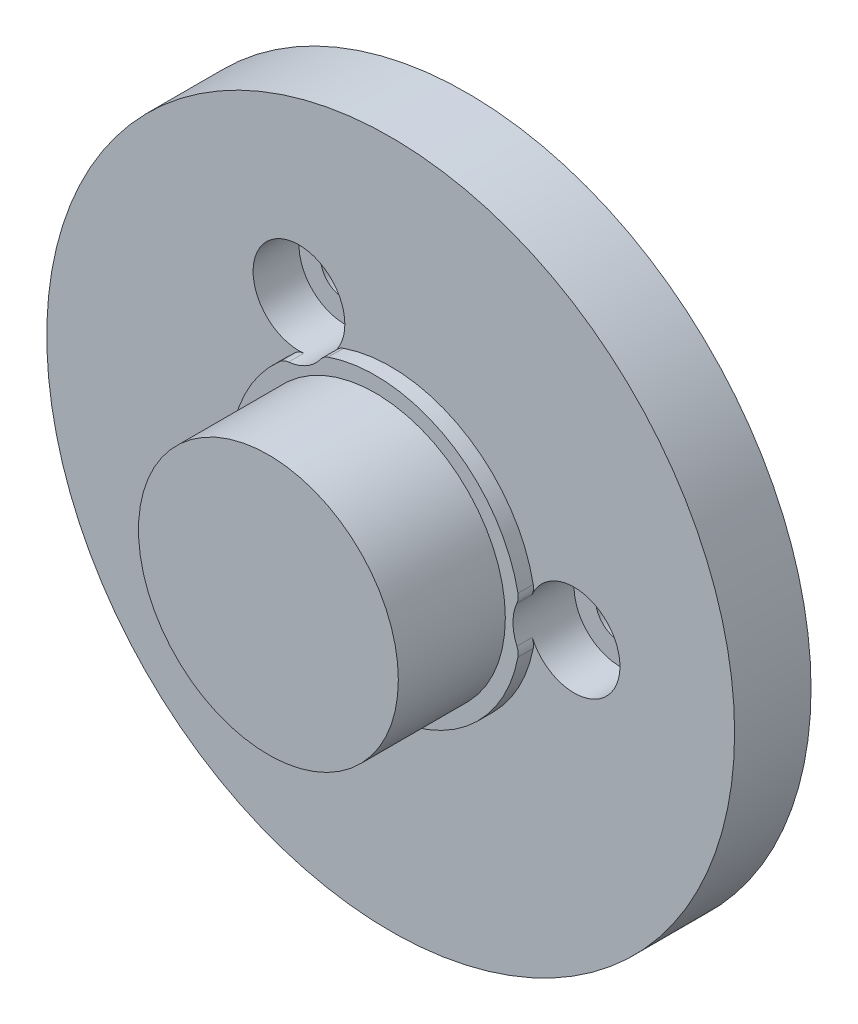
from build123d import *
from build123d.topology import SkipClean

# Parameters (mm, degrees)
SKETCH1_R           = 22.499999999999996
SKETCH1_R_2         = 1.6
SKETCH1_R_3         = 1.6000000000000016
BOSS_EXTRUDE1_DEPTH = 5
SKETCH2_R           = 3.0000000000000004
SKETCH2_R_2         = 2.999999999999999
CUT_EXTRUDE1_DEPTH  = 3
BOSS_EXTRUDE2_START = 1
BOSS_EXTRUDE2_DEPTH = 1
SKETCH4_R           = 8.499999999997954
BOSS_EXTRUDE3_DEPTH = 7
FILLET1_R           = 1


with BuildPart() as part:
    # Sketch1 → Boss-Extrude1 (new body)
    with BuildSketch(Plane.XY.offset(31)):
        Circle(SKETCH1_R)
        with Locations((-6.000000000000005, 10.392304845413262)):
            Circle(SKETCH1_R_2, mode=Mode.SUBTRACT)
        with Locations((-5.999999999999998, -10.392304845413266)):
            Circle(SKETCH1_R_2, mode=Mode.SUBTRACT)
        with Locations((12, 0)):
            Circle(SKETCH1_R_3, mode=Mode.SUBTRACT)
    extrude(amount=BOSS_EXTRUDE1_DEPTH)

    # Sketch2 → Cut-Extrude1 (cut)
    with BuildSketch(Plane.XY.offset(36)):
        with Locations((-6.000000000000005, 10.392304845413262)):
            Circle(SKETCH2_R)
        with Locations((12, 0)):
            Circle(SKETCH2_R_2)
        with Locations((-5.999999999999998, -10.392304845413266)):
            Circle(SKETCH2_R)
    extrude(amount=-CUT_EXTRUDE1_DEPTH, mode=Mode.SUBTRACT)

    # Sketch3 → Boss-Extrude2 (add)
    with SkipClean():  # the faces are left unmerged after this step: merging them gives an invalid solid
        with BuildSketch(Plane.XY.offset(36).offset(BOSS_EXTRUDE2_START)):
            with BuildLine():
                ThreePointArc((9.385416666666513, -1.4710384063833113), (9, -2.3e-15), (9.385416666666512, 1.4710384063833084))
                ThreePointArc((9.385416666666718, 1.4710384063832629), (4.750000000000321, 8.227241335951982), (-3.4187517034621835, 8.863528461627142))
                ThreePointArc((-3.41875170346237, 8.863528461627341), (-4.500000000000021, 7.794228634059937), (-5.966664963204541, 7.392490055243401))
                ThreePointArc((-5.966664963204453, 7.392490055243118), (-9.5, -7.27e-15), (-5.966664963204442, -7.392490055243128))
                ThreePointArc((-5.966664963204531, -7.392490055243405), (-4.500000000000005, -7.794228634059945), (-3.418751703462356, -8.863528461627357))
                ThreePointArc((-3.418751703462164, -8.86352846162715), (4.750000000000329, -8.227241335951977), (9.385416666666718, -1.471038406383265))
            make_face()
        extrude(amount=-BOSS_EXTRUDE2_DEPTH)

    # Sketch4 → Boss-Extrude3 (add)
    with SkipClean():  # the faces are left unmerged after this step: merging them gives an invalid solid
        with BuildSketch(Plane.XY.offset(37)):
            Circle(SKETCH4_R)
        extrude(amount=BOSS_EXTRUDE3_DEPTH)

    # Fillet1
    fillet1_edges = [part.edges().sort_by_distance(p)[0] for p in [
        (9.385416666666615, 1.4710384063832855, 36.5),
        (-5.966664963204497, 7.39249005524326, 36.5),
        (-3.41875170346226, -8.863528461627254, 36.5),
        (-3.4187517034622763, 8.863528461627242, 36.5),
        (-5.966664963204487, -7.392490055243267, 36.5),
        (9.385416666666615, -1.4710384063832884, 36.5),
    ]]
    fillet(fillet1_edges, radius=FILLET1_R)


solid = part.part
